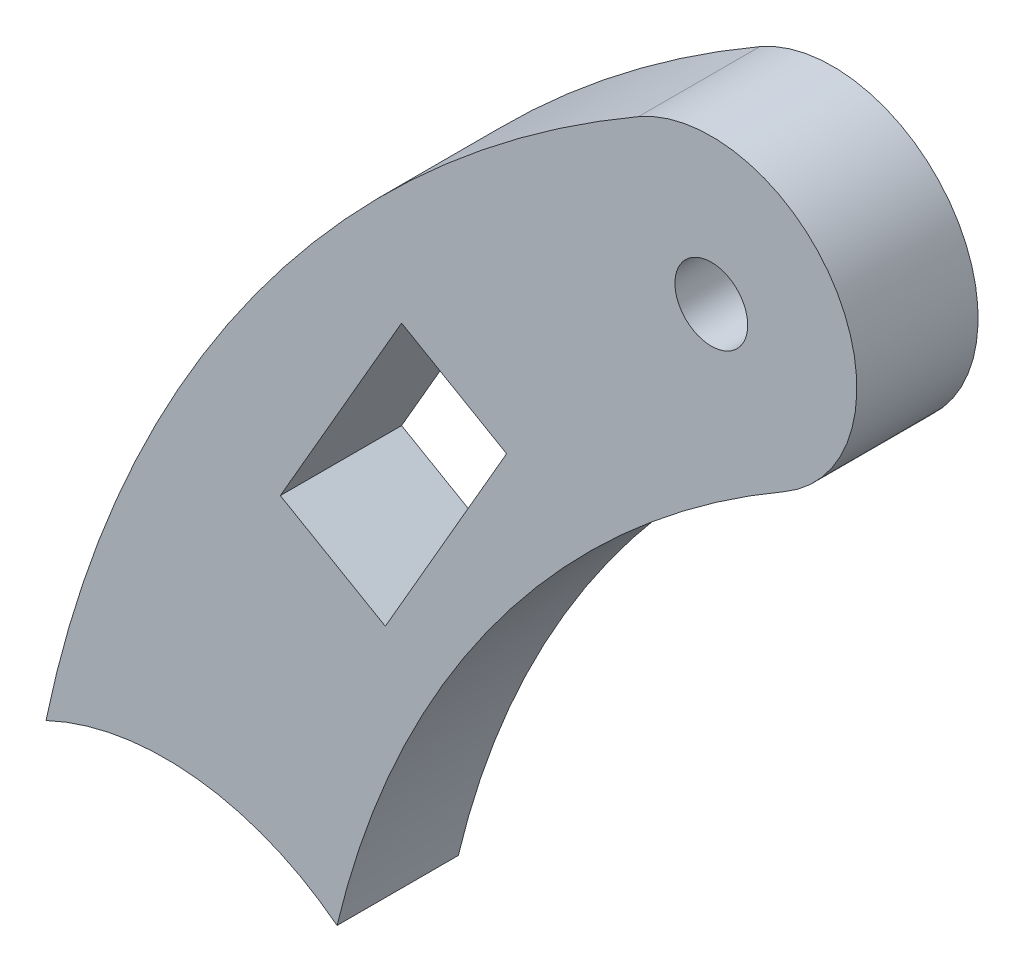
from build123d import *

# Parameters (mm, degrees)
ESQUISSE1_R        = 1.5
BOSS_EXTRU_1_DEPTH = 5


with BuildPart() as part:
    # Esquisse1 → Boss.-Extru.1 (new body)
    with BuildSketch(Plane.XY):
        with BuildLine():
            ThreePointArc((-25.5, 44.167295593), (-41.32406979, 29.888480322), (-49.930555556, 10.389399497))
            ThreePointArc((-49.930555556, 10.389399497), (-43.743567635, 11.431158196), (-37.930555556, 9.070444049))
            ThreePointArc((-37.930555556, 9.070444049), (-31.259331963, 23.320681063), (-19.5, 33.774990748))
            ThreePointArc((-19.5, 33.774990748), (-17.303847577, 41.97114317), (-25.5, 44.167295593))
        make_face()
        with Locations((-22.5, 38.97114317)):
            Circle(ESQUISSE1_R, mode=Mode.SUBTRACT)
        Polygon((-40.270181276, 23.25), (-35.940054257, 20.75), (-30.940054257, 29.410254038), (-35.270181276, 31.910254038), align=None, mode=Mode.SUBTRACT)
    extrude(amount=BOSS_EXTRU_1_DEPTH)


solid = part.part
